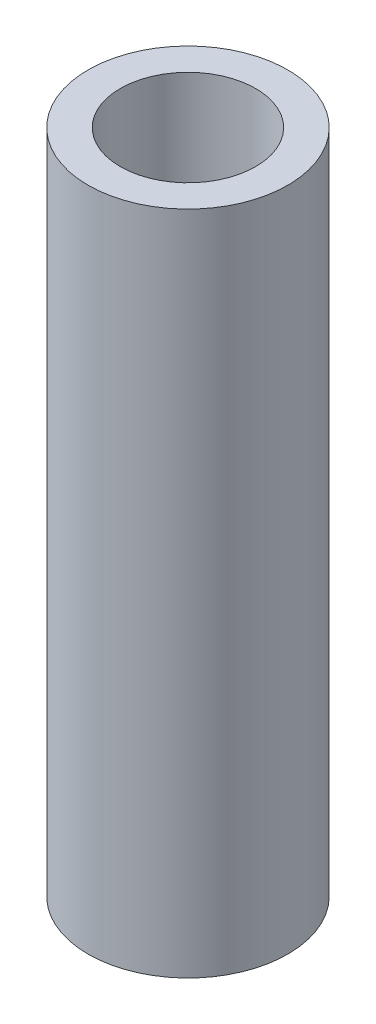
from build123d import *

# Parameters (mm, degrees)
SKETCH1_R           = 4.5
BOSS_EXTRUDE1_DEPTH = 30
SKETCH2_R           = 3.05
CUT_EXTRUDE1_DEPTH  = 31.66757245


with BuildPart() as part:
    # Sketch1 → Boss-Extrude1 (new body)
    with BuildSketch(Plane(origin=(0, 0, 0), x_dir=(1, 0, 0), z_dir=(0, 1, 0))):
        Circle(SKETCH1_R)
    extrude(amount=BOSS_EXTRUDE1_DEPTH)

    # Sketch2 → Cut-Extrude1 (cut, through all)
    with BuildSketch(Plane(origin=(0, 30, 0), x_dir=(1, 0, 0), z_dir=(0, 1, 0))):
        Circle(SKETCH2_R)
    extrude(amount=-CUT_EXTRUDE1_DEPTH, mode=Mode.SUBTRACT)


solid = part.part
